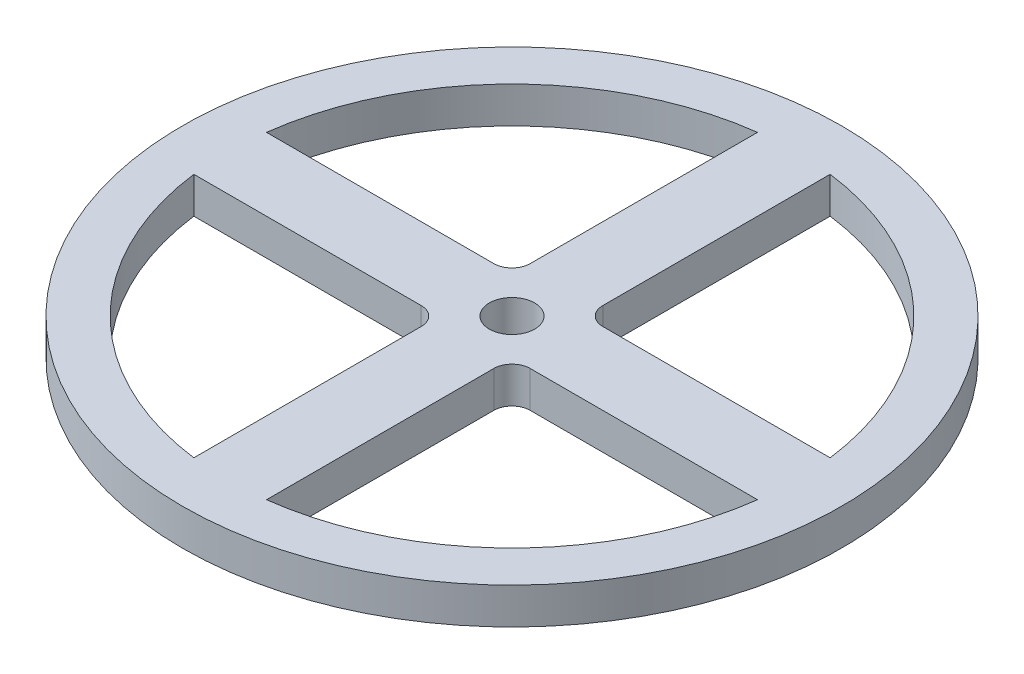
from build123d import *

# Parameters (mm, degrees)
SKETCH1_R           = 36.3
SKETCH1_R_2         = 2.5
BOSS_EXTRUDE1_DEPTH = 4


with BuildPart() as part:
    # Sketch1 → Boss-Extrude1 (new body)
    with BuildSketch(Plane(origin=(0, 0, 0), x_dir=(1, 0, 0), z_dir=(0, 1, 0))):
        Circle(SKETCH1_R)
        with BuildLine():
            ThreePointArc((-4, -31.043356777), (-22.132442251, -22.132442251), (-31.043356777, -4))
            Line((-31.043356777, -4), (-6, -4))
            ThreePointArc((-6, -4), (-4.585786438, -4.585786438), (-4, -6))
            Line((-4, -6), (-4, -31.043356777))
        make_face(mode=Mode.SUBTRACT)
        with BuildLine():
            ThreePointArc((4, -6), (4.585786438, -4.585786438), (6, -4))
            Line((6, -4), (31.043356777, -4))
            ThreePointArc((31.043356777, -4), (22.132442251, -22.132442251), (4, -31.043356777))
            Line((4, -31.043356777), (4, -6))
        make_face(mode=Mode.SUBTRACT)
        with BuildLine():
            ThreePointArc((-31.043356777, 4), (-22.132442251, 22.132442251), (-4, 31.043356777))
            Line((-4, 31.043356777), (-4, 6))
            ThreePointArc((-4, 6), (-4.585786438, 4.585786438), (-6, 4))
            Line((-6, 4), (-31.043356777, 4))
        make_face(mode=Mode.SUBTRACT)
        Circle(SKETCH1_R_2, mode=Mode.SUBTRACT)
        with BuildLine():
            Line((4, 6), (4, 31.043356777))
            ThreePointArc((4, 31.043356777), (22.132442251, 22.132442251), (31.043356777, 4))
            Line((31.043356777, 4), (6, 4))
            ThreePointArc((6, 4), (4.585786438, 4.585786438), (4, 6))
        make_face(mode=Mode.SUBTRACT)
    extrude(amount=BOSS_EXTRUDE1_DEPTH)


solid = part.part
